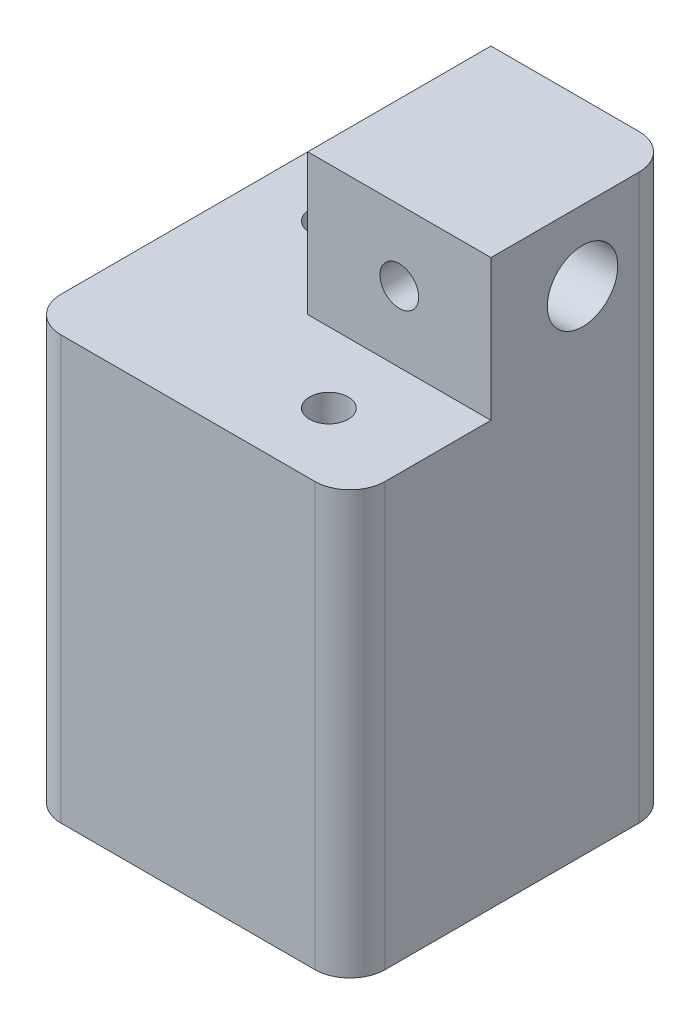
from build123d import *

# Parameters (mm, degrees)
SKETCH1_W           = 46
SKETCH1_H           = 46
BOSS_EXTRUDE1_DEPTH = 80
CUT_EXTRUDE1_DEPTH  = 20
SKETCH3_R           = 5
CUT_EXTRUDE2_DEPTH  = 21
SKETCH4_R           = 5
CUT_EXTRUDE3_DEPTH  = 21
SKETCH5_R           = 2.75
CUT_EXTRUDE4_DEPTH  = 104.111590037
SKETCH6_R           = 2.75
CUT_EXTRUDE5_DEPTH  = 104.111590037
FILLET1_R           = 5
SKETCH9_R           = 2.75
CUT_EXTRUDE8_DEPTH  = 104.111590037
SKETCH10_R          = 2.75
CUT_EXTRUDE9_DEPTH  = 89.498587559
SKETCH11_R          = 5
CUT_EXTRUDE10_DEPTH = 55


with BuildPart() as part:
    # Sketch1 → Boss-Extrude1 (new body)
    with BuildSketch(Plane(origin=(0, 0, 0), x_dir=(1, 0, 0), z_dir=(0, 1, 0))):
        with Locations((23, 23)):
            Rectangle(SKETCH1_W, SKETCH1_H)
    extrude(amount=BOSS_EXTRUDE1_DEPTH)

    # Sketch2 → Cut-Extrude1 (cut)
    with BuildSketch(Plane(origin=(0, 80, 0), x_dir=(1, 0, 0), z_dir=(0, 1, 0))):
        Polygon((0, 46), (20, 46), (20, 20), (46, 20), (46, 0), (20, 0), (0, 0), align=None)
    extrude(amount=-CUT_EXTRUDE1_DEPTH, mode=Mode.SUBTRACT)

    # Sketch3 → Cut-Extrude2 (cut)
    with BuildSketch(Plane(origin=(46, 0, 0), x_dir=(0, 0, -1), z_dir=(1, 0, 0))):
        with Locations((33, 70)):
            Circle(SKETCH3_R)
    extrude(amount=-CUT_EXTRUDE2_DEPTH, mode=Mode.SUBTRACT)

    # Sketch4 → Cut-Extrude3 (cut)
    with BuildSketch(Plane(origin=(0, 0, -46), x_dir=(-1, 0, 0), z_dir=(0, 0, -1))):
        with Locations((-33, 70)):
            Circle(SKETCH4_R)
    extrude(amount=-CUT_EXTRUDE3_DEPTH, mode=Mode.SUBTRACT)

    # Sketch5 → Cut-Extrude4 (cut, through all)
    with BuildSketch(Plane(origin=(0, 0, -46), x_dir=(-1, 0, 0), z_dir=(0, 0, -1))):
        with Locations((-33, 70)):
            Circle(SKETCH5_R)
    extrude(amount=-CUT_EXTRUDE4_DEPTH, mode=Mode.SUBTRACT)

    # Sketch6 → Cut-Extrude5 (cut, through all)
    with BuildSketch(Plane(origin=(46, 0, 0), x_dir=(0, 0, -1), z_dir=(1, 0, 0))):
        with Locations((33, 70)):
            Circle(SKETCH6_R)
    extrude(amount=-CUT_EXTRUDE5_DEPTH, mode=Mode.SUBTRACT)

    # Fillet1
    fillet1_edges = [part.edges().sort_by_distance(p)[0] for p in [
        (0, 30, -46),
        (0, 30, 0),
        (46, 30, 0),
        (46, 40, -46),
    ]]
    fillet(fillet1_edges, radius=FILLET1_R)

    # Sketch9 → Cut-Extrude8 (cut, through all)
    with BuildSketch(Plane.XZ):
        with Locations((10, -33)):
            Circle(SKETCH9_R)
    extrude(amount=-CUT_EXTRUDE8_DEPTH, mode=Mode.SUBTRACT)

    # Sketch10 → Cut-Extrude9 (cut, through all)
    with BuildSketch(Plane(origin=(0, 60, 0), x_dir=(1, 0, 0), z_dir=(0, 1, 0))):
        with Locations((33, 10)):
            Circle(SKETCH10_R)
    extrude(amount=-CUT_EXTRUDE9_DEPTH, mode=Mode.SUBTRACT)

    # Sketch11 → Cut-Extrude10 (cut)
    with BuildSketch(Plane.XZ):
        with Locations((33, -10)):
            Circle(SKETCH11_R)
        with Locations((10, -33)):
            Circle(SKETCH11_R)
    extrude(amount=-CUT_EXTRUDE10_DEPTH, mode=Mode.SUBTRACT)


solid = part.part
